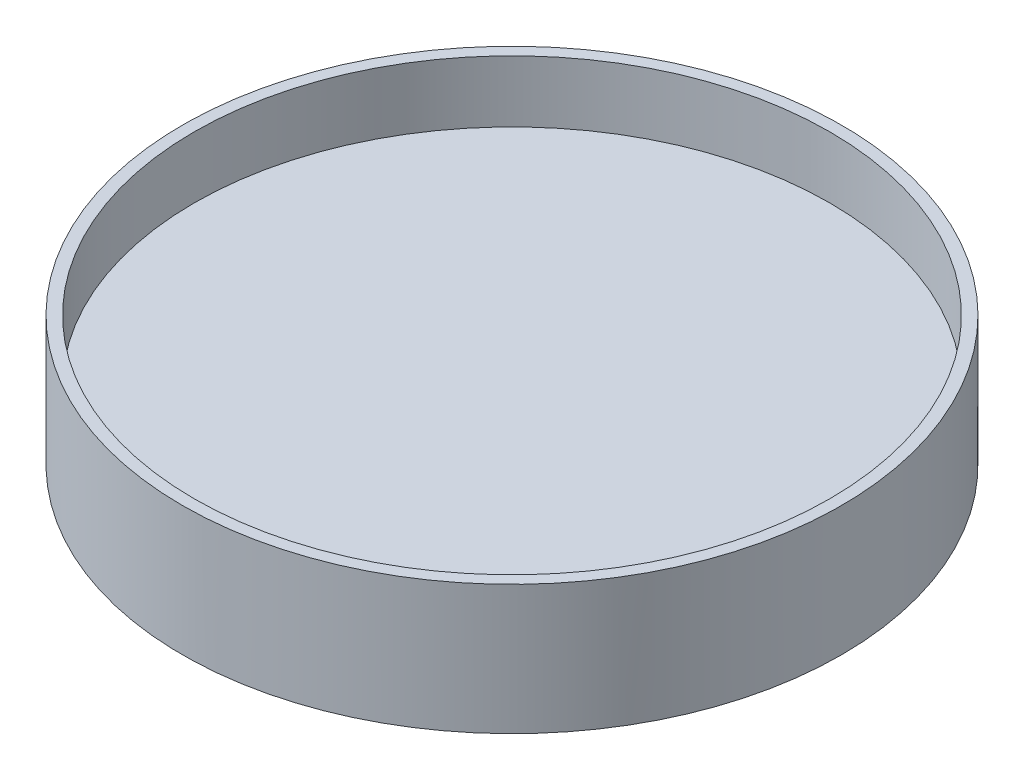
from build123d import *

# Parameters (mm, degrees)
SKETCH1_R            = 53.5
BOSS_EXTRUDE1_DEPTH  = 2
SKETCH2_R            = 53.5
SKETCH2_R_2          = 51.6
BOSS_EXTRUDE2_DEPTH  = 10
BOSS_EXTRUDE3_START  = 9
SKETCH4_R            = 53.5
BOSS_EXTRUDE3_DEPTH  = 9
SKETCH6_W            = 36
SKETCH6_H            = 36
CUT_EXTRUDE1_DEPTH   = 6.5
CUT_EXTRUDE2_START   = -36
CUT_EXTRUDE2_DEPTH   = 36
CUT_EXTRUDE2_2_DEPTH = 36
CUT_EXTRUDE2_START_2 = -19
CUT_EXTRUDE2_3_DEPTH = 38
SKETCH14_R           = 2.35
CUT_EXTRUDE3_DEPTH   = 4
SKETCH15_W           = 36
SKETCH15_H           = 71.5
CUT_EXTRUDE4_DEPTH   = 2


with BuildPart() as part:
    # Sketch1 → Boss-Extrude1 (new body)
    with BuildSketch(Plane(origin=(0, 0, 0), x_dir=(1, 0, 0), z_dir=(0, 1, 0))):
        with Locations(Location((0, 0, 0), (0, 0, 270))):
            Circle(SKETCH1_R)
    extrude(amount=BOSS_EXTRUDE1_DEPTH)

    # Sketch2 → Boss-Extrude2 (add)
    with BuildSketch(Plane(origin=(0, 2, 0), x_dir=(1, 0, 0), z_dir=(0, 1, 0))):
        with Locations(Location((0, 0, 0), (0, 0, 270))):
            Circle(SKETCH2_R)
        with Locations(Location((0, 0, 0), (0, 0, 270))):
            Circle(SKETCH2_R_2, mode=Mode.SUBTRACT)
    extrude(amount=BOSS_EXTRUDE2_DEPTH)

    # Sketch4 → Boss-Extrude3 (add)
    with BuildSketch(Plane.XZ.offset(BOSS_EXTRUDE3_START)):
        with Locations(Location((0, 0, 0), (0, 0, 270))):
            Circle(SKETCH4_R)
    extrude(amount=-BOSS_EXTRUDE3_DEPTH)

    # Sketch6 → Cut-Extrude1 (cut)
    with BuildSketch(Plane.XZ.offset(9)):
        Rectangle(SKETCH6_W, SKETCH6_H)
    extrude(amount=-CUT_EXTRUDE1_DEPTH, mode=Mode.SUBTRACT)

    # Cut-Extrude2: read off the stored shape, not the designer's step
    # Cut-Extrude2 outline → Cut-Extrude2 (cut)
    with BuildSketch(Plane.XY.offset(-18).offset(CUT_EXTRUDE2_START)):
        Polygon((15.634193477, -9), (18, -2.5), (-18, -2.5), (-15.634193477, -9), align=None)
    extrude(amount=CUT_EXTRUDE2_DEPTH, mode=Mode.SUBTRACT)

    # Cut-Extrude2 2 outline → Cut-Extrude2 2 (add)
    with BuildSketch(Plane.XY.offset(-18)):
        Polygon((18, -9), (18, -2.5), (15.634193477, -9), align=None)
        Polygon((-15.634193477, -9), (-18, -2.5), (-18, -9), align=None)
    extrude(amount=CUT_EXTRUDE2_2_DEPTH)

    # Cut-Extrude2 3 outline → Cut-Extrude2 3 (add)
    with BuildSketch(Plane.YZ.offset(CUT_EXTRUDE2_START_2)):
        Polygon((-9, 18), (-9, 15.634193477), (-2.5, 18), align=None)
    extrude(amount=CUT_EXTRUDE2_3_DEPTH)

    # Sketch14 → Cut-Extrude3 (cut)
    with BuildSketch(Plane.XZ.offset(2.5)):
        with Locations(Location((0, -37, 0), (0, 0, 270))):
            Circle(SKETCH14_R)
    extrude(amount=-CUT_EXTRUDE3_DEPTH, mode=Mode.SUBTRACT)

    # Sketch15 → Cut-Extrude4 (cut)
    with BuildSketch(Plane.XZ.offset(2.5)):
        with Locations((0, -17.75)):
            Rectangle(SKETCH15_W, SKETCH15_H)
    extrude(amount=-CUT_EXTRUDE4_DEPTH, mode=Mode.SUBTRACT)


solid = part.part
